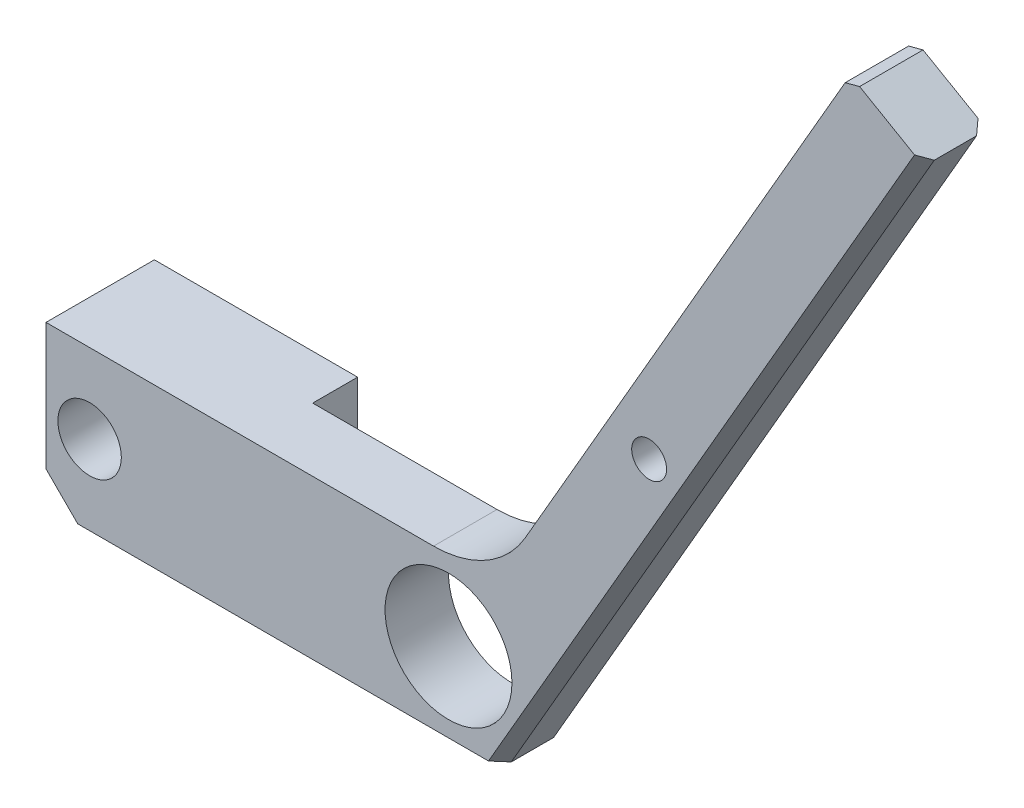
from build123d import *

# Parameters (mm, degrees)
SKETCH1_R                       = 3
SKETCH1_R_2                     = 6
BOSS_EXTRUDE1_DEPTH             = 6
M4X0_7_TAPPED_HOLE1_D           = 3.3
CHAMFER1_SIZE                   = 3
CHAMFER2_SIZE                   = 1
BOSS_EXTRUDE2_DEPTH             = 4.25
M4X0_7_START                    = -20.526744186
M4X0_7_TAPPED_HOLE3_OUTLINE_R   = 1.65
M4X0_7_TAPPED_HOLE3_DEPTH       = 1.123131525
M4X0_7_START_2                  = -19.403612661
M4X0_7_TAPPED_HOLE3_2_OUTLINE_R = 1.65
M4X0_7_TAPPED_HOLE3_2_DEPTH     = 0.494491736
M4X0_7_START_3                  = -6.0000001
M4X0_7_TAPPED_HOLE3_3_DEPTH     = 6.0000002
M4X0_7_START_4                  = -6.7750001
M4X0_7_TAPPED_HOLE3_4_DEPTH     = 0.775
SKETCH14_R                      = 3
CUT_EXTRUDE1_DEPTH              = 87.67199356


with BuildPart() as part:
    # Sketch1 → Boss-Extrude1 (new body)
    with BuildSketch(Plane.XY):
        with BuildLine():
            Line((62.473255814, 56.275636954), (55.545052584, 60.275636954))
            Line((55.545052584, 60.275636954), (24.782656891, 6.993604651))
            ThreePointArc((24.782656891, 6.993604651), (21.122402853, 3.333350613), (16.122402853, 1.993604651))
            Line((16.122402853, 1.993604651), (-20.526744186, 1.993604651))
            Line((-20.526744186, 1.993604651), (-20.526744186, -13.006395349))
            Line((-20.526744186, -13.006395349), (22.473255814, -13.006395349))
            Line((22.473255814, -13.006395349), (62.473255814, 56.275636954))
        make_face()
        with Locations((-16.403612561, -5.506395349)):
            Circle(SKETCH1_R, mode=Mode.SUBTRACT)
        with Locations((17.535345593, -5.506395349)):
            Circle(SKETCH1_R_2, mode=Mode.SUBTRACT)
    extrude(amount=-BOSS_EXTRUDE1_DEPTH)

    # M4x0.7 Tapped Hole1 (through all)
    with Locations(Plane.XY):
        with Locations((36.509154199, 19.304493784)):
            Hole(M4X0_7_TAPPED_HOLE1_D / 2)

    # Chamfer1
    chamfer1_edges = [part.edges().sort_by_distance(p)[0] for p in [
        (-20.526744186, -13.006395349, -3),
    ]]
    chamfer(chamfer1_edges, length=CHAMFER1_SIZE)

    # Chamfer2
    chamfer2_edges = [part.edges().sort_by_distance(p)[0] for p in [
        (42.473255814, 21.634620803, -6),
        (55.545052584, 60.275636954, -3),
        (42.473255814, 21.634620803, 0),
    ]]
    chamfer(chamfer2_edges, length=CHAMFER2_SIZE)

    # Sketch6 → Boss-Extrude2 (add)
    with BuildSketch(Plane(origin=(0, 0, -6), x_dir=(-1, 0, 0), z_dir=(0, 0, -1))):
        Polygon((20.526744186, 1.993604651), (1.306644629, 1.993604651), (1.306644629, -13.006395349), (17.526744186, -13.006395349), (20.526744186, -10.006395349), align=None)
    extrude(amount=BOSS_EXTRUDE2_DEPTH)

    # M4x0.7 Tapped Hole3: read off the stored shape, not the designer's step
    # M4x0.7 Tapped Hole3 outline → M4x0.7 Tapped Hole3 (cut)
    with BuildSketch(Plane.YZ.offset(M4X0_7_START)):
        with Locations((-5.506395349, -5.125)):
            Circle(M4X0_7_TAPPED_HOLE3_OUTLINE_R)
    extrude(amount=M4X0_7_TAPPED_HOLE3_DEPTH, mode=Mode.SUBTRACT)

    # M4x0.7 Tapped Hole3 2 outline → M4x0.7 Tapped Hole3 2 (cut)
    with BuildSketch(Plane.YZ.offset(M4X0_7_START_2)):
        with Locations((-5.506395349, -5.125)):
            Circle(M4X0_7_TAPPED_HOLE3_2_OUTLINE_R)
    extrude(amount=M4X0_7_TAPPED_HOLE3_2_DEPTH, mode=Mode.SUBTRACT)

    # M4x0.7 Tapped Hole3 3 outline → M4x0.7 Tapped Hole3 3 (cut)
    with BuildSketch(Plane.XY.offset(M4X0_7_START_3)):
        with BuildLine():
            ThreePointArc((-18.909118414, -3.856413403), (-18.986363136, -3.980158321), (-19.057501217, -4.107511865))
            ThreePointArc((-19.057501217, -4.107511865), (-19.403612561, -5.506395898), (-19.057500704, -6.905279805))
            ThreePointArc((-19.057500704, -6.905279805), (-18.98636247, -7.032633505), (-18.909117577, -7.156378566))
            Line((-18.909117577, -7.156378566), (-18.909118414, -3.856413403))
        make_face()
    extrude(amount=M4X0_7_TAPPED_HOLE3_3_DEPTH, mode=Mode.SUBTRACT)

    # M4x0.7 Tapped Hole3 4 outline → M4x0.7 Tapped Hole3 4 (add)
    with BuildSketch(Plane.XY.offset(M4X0_7_START_4)):
        with BuildLine():
            ThreePointArc((-18.909118414, -3.856413403), (-18.986363136, -3.980158321), (-19.057501217, -4.107511865))
            ThreePointArc((-19.057501217, -4.107511865), (-19.403612561, -5.506395898), (-19.057500704, -6.905279805))
            ThreePointArc((-19.057500704, -6.905279805), (-18.98636247, -7.032633505), (-18.909117577, -7.156378566))
            Line((-18.909117577, -7.156378566), (-18.909118414, -3.856413403))
        make_face()
    extrude(amount=M4X0_7_TAPPED_HOLE3_4_DEPTH)

    # Sketch14 → Cut-Extrude1 (cut, through all)
    with BuildSketch(Plane.XY.offset(-6)):
        with Locations((-16.403612561, -5.506395349)):
            Circle(SKETCH14_R)
    extrude(amount=-CUT_EXTRUDE1_DEPTH, mode=Mode.SUBTRACT)


solid = part.part
